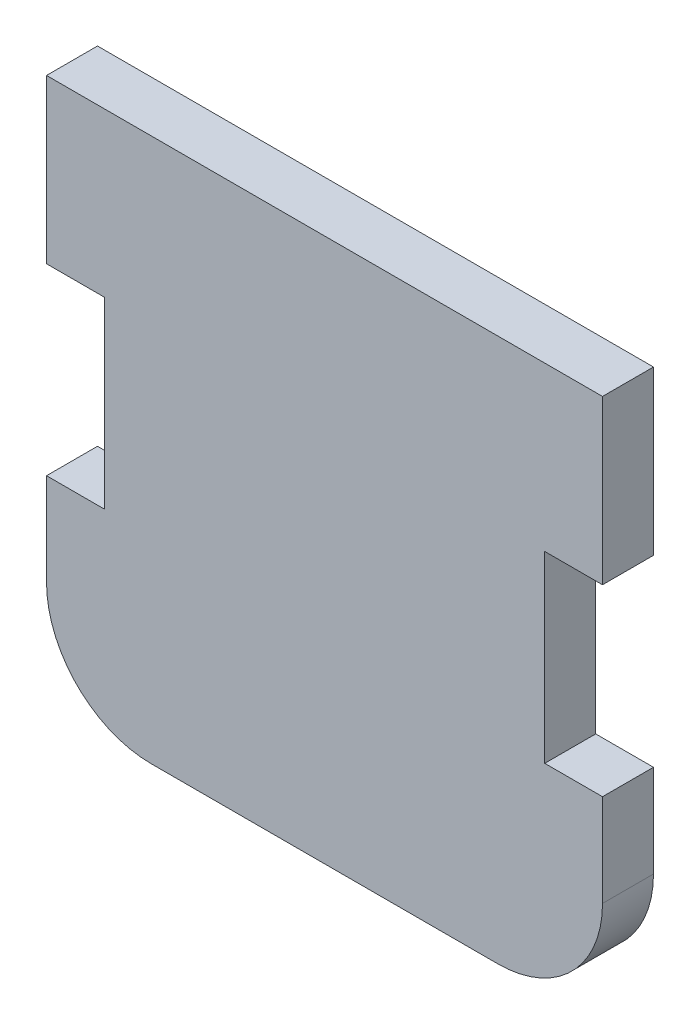
from build123d import *

# Parameters (mm, degrees)
BOSS_EXTRUDE1_DEPTH = 1.905
SKETCH2_W           = 2.413
SKETCH2_H           = 6.858
CUT_EXTRUDE1_DEPTH  = 454.76030973


with BuildPart() as part:
    # Sketch1 → Boss-Extrude1 (new body)
    with BuildSketch(Plane.XY):
        with BuildLine():
            Line((-434.4289, 0), (-432.5239, 0))
            Line((-432.5239, 0), (-432.5239, -6.35))
            Line((-432.5239, -6.35), (-432.5239, -12.7))
            Line((-432.5239, -12.7), (-432.5239, -16.4084))
            ThreePointArc((-432.5239, -16.4084), (-433.669581115, -19.174318885), (-436.4355, -20.32))
            Line((-436.4355, -20.32), (-449.3895, -20.32))
            ThreePointArc((-449.3895, -20.32), (-452.155418885, -19.174318885), (-453.3011, -16.4084))
            Line((-453.3011, -16.4084), (-453.3011, -12.7))
            Line((-453.3011, -12.7), (-453.3011, -6.35))
            Line((-453.3011, -6.35), (-453.3011, 0))
            Line((-453.3011, 0), (-451.3961, 0))
            Line((-451.3961, 0), (-434.4289, 0))
        make_face()
    extrude(amount=BOSS_EXTRUDE1_DEPTH)

    # Sketch2 → Cut-Extrude1 (cut, through all)
    with BuildSketch(Plane.XY.offset(1.905)):
        with Locations((-433.4764, -9.525)):
            Rectangle(SKETCH2_W, SKETCH2_H)
        with Locations((-452.3486, -9.525)):
            Rectangle(SKETCH2_W, SKETCH2_H)
    extrude(amount=-CUT_EXTRUDE1_DEPTH, mode=Mode.SUBTRACT)


solid = part.part
